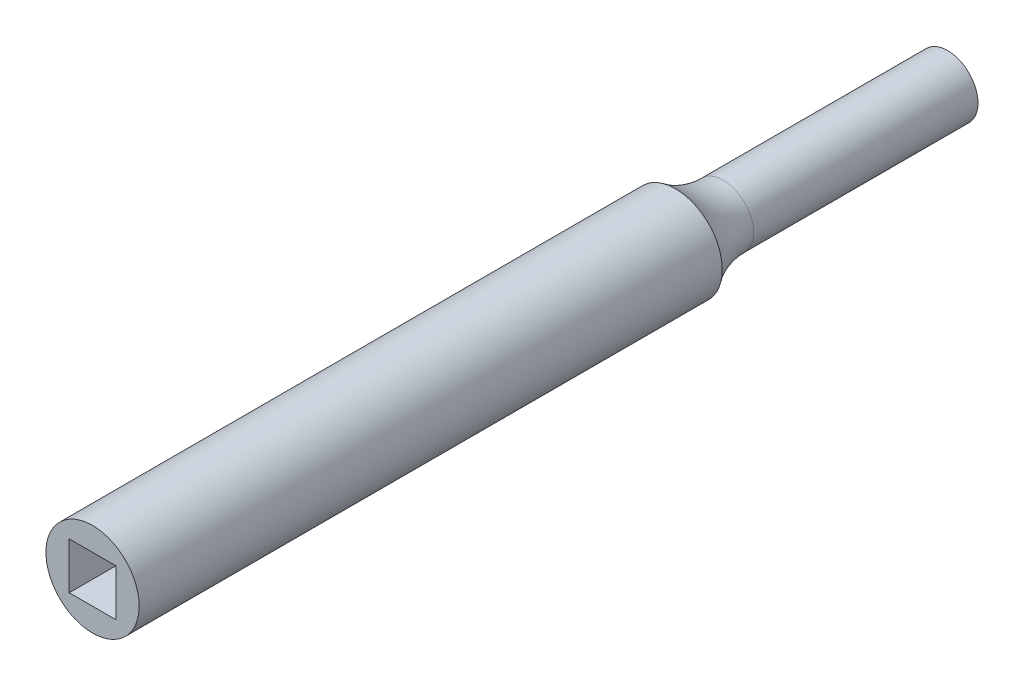
from build123d import *

# Parameters (mm, degrees)
SKETCH5_R           = 3.9
BOSS_EXTRUDE4_DEPTH = 35
SKETCH6_R           = 6
BOSS_EXTRUDE5_DEPTH = 75
FILLET1_R           = 10
SKETCH7_W           = 6
SKETCH7_H           = 6
CUT_EXTRUDE1_DEPTH  = 20


with BuildPart() as part:
    # Sketch5 → Boss-Extrude4 (new body)
    with BuildSketch(Plane.XY):
        Circle(SKETCH5_R)
    extrude(amount=BOSS_EXTRUDE4_DEPTH)

    # Sketch6 → Boss-Extrude5 (add)
    with BuildSketch(Plane.XY.offset(35)):
        Circle(SKETCH6_R)
    extrude(amount=BOSS_EXTRUDE5_DEPTH)

    # Fillet1
    # the kernel refuses this fillet: 10 mm, written as the material it adds along each edge
    with BuildSketch(Plane(origin=(0, 0, 35), x_dir=(1, 0, 0), z_dir=(0, -1, 0))) as fillet1_piece_1:
        with BuildLine():
            CenterArc((13.9, -6.131068422), FILLET1_R, 142.185511494, 37.814488506)
            Line((3.9, -6.131068422), (3.7, -6.131068422))
            Line((3.7, -6.131068422), (3.7, 0))
            Line((3.7, 0), (3.9, 0.2))
            ThreePointArc((3.9, 0.2), (4.95, 0.2), (5.842, 0.122621368))
            Line((5.842, 0.122621368), (6, 0))
        make_face()
    revolve(axis=Axis((0, 0, 35), (0, 0, 1)))

    # Sketch7 → Cut-Extrude1 (cut)
    with BuildSketch(Plane.XY.offset(110)):
        Rectangle(SKETCH7_W, SKETCH7_H)
    extrude(amount=-CUT_EXTRUDE1_DEPTH, mode=Mode.SUBTRACT)


solid = part.part
